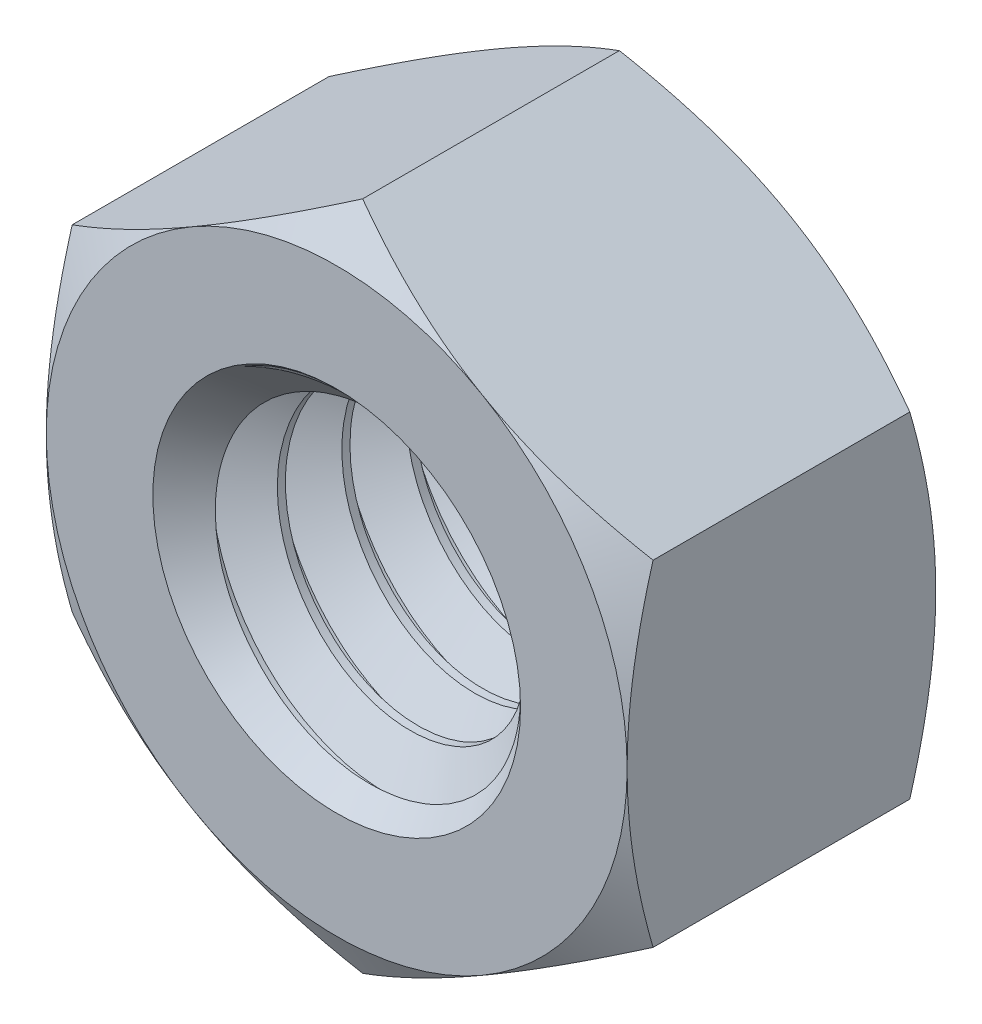
from build123d import *

# Parameters (mm, degrees)
EXTRUDE1_DEPTH     = 6.746875
SKETCH2_OUTSIDE_W  = 63.202
SKETCH2_OUTSIDE_H  = 65.166
SKETCH2_OUTSIDE_R  = 6.35
CUT_EXTRUDE6_DEPTH = 12.815504881
CUT_EXTRUDE6_DRAFT = -60
SKETCH4_OUTSIDE_W  = 40.804
SKETCH4_OUTSIDE_H  = 42.768
SKETCH4_OUTSIDE_R  = 6.35
CUT_EXTRUDE3_DEPTH = 6.35
CUT_EXTRUDE3_DRAFT = -60
SKETCH5_R          = 3.96875
CUT_EXTRUDE4_DEPTH = 12.815504881
SWEEP1_PITCH       = 1.411111111
SKETCH8_R          = 4.47675
CUT_EXTRUDE5_DEPTH = 13.561737951
CUT_EXTRUDE8_DEPTH = 12.815504992


with BuildPart() as part:
    # Sketch1 → Extrude1 (new body)
    with BuildSketch(Plane.XY):
        Polygon((0, 7.332348419), (-6.35, 3.666174209), (-6.35, -3.666174209), (0, -7.332348419), (6.35, -3.666174209), (6.35, 3.666174209), align=None)
    extrude(amount=-EXTRUDE1_DEPTH)


with BuildPart() as cut_extrude6_tool:
    # Sketch2 outside → Cut-Extrude6 (with draft: the straight prism first)
    with BuildSketch(Plane.XY):
        Rectangle(SKETCH2_OUTSIDE_W, SKETCH2_OUTSIDE_H)
        Circle(SKETCH2_OUTSIDE_R, mode=Mode.SUBTRACT)
    extrude(amount=-CUT_EXTRUDE6_DEPTH)
    # Cut-Extrude6: the draft: its side faces are tilted about the plane it starts from
    cut_extrude6_sides = [cut_extrude6_tool.faces().sort_by_distance(p)[0] for p in [
        (0, -32.583, -6.407752441),
        (31.601, 0, -6.407752441),
        (0, 32.583, -6.407752441),
        (-31.601, 0, -6.407752441),
        (-6.35, 0, -6.407752441),
    ]]
    draft(cut_extrude6_sides, Plane.XY, CUT_EXTRUDE6_DRAFT)


with BuildPart() as part_1:
    add(part.part)

    # Cut-Extrude6: cut by cut_extrude6_tool
    add(cut_extrude6_tool.part, mode=Mode.SUBTRACT)


with BuildPart() as cut_extrude3_tool:
    # Sketch4 outside → Cut-Extrude3 (with draft: the straight prism first)
    with BuildSketch(Plane(origin=(0, 0, -6.746875), x_dir=(-1, 0, 0), z_dir=(0, 0, -1))):
        Rectangle(SKETCH4_OUTSIDE_W, SKETCH4_OUTSIDE_H)
        Circle(SKETCH4_OUTSIDE_R, mode=Mode.SUBTRACT)
    extrude(amount=-CUT_EXTRUDE3_DEPTH)
    # Cut-Extrude3: the draft: its side faces are tilted about the plane it starts from
    cut_extrude3_sides = [cut_extrude3_tool.faces().sort_by_distance(p)[0] for p in [
        (0, -21.384, -3.571875),
        (-20.402, 0, -3.571875),
        (0, 21.384, -3.571875),
        (20.402, 0, -3.571875),
        (6.35, 0, -3.571875),
    ]]
    draft(cut_extrude3_sides, Plane(origin=(0, 0, -6.746875), x_dir=(-1, 0, 0), z_dir=(0, 0, -1)), CUT_EXTRUDE3_DRAFT)


with BuildPart() as part_2:
    add(part_1.part)

    # Cut-Extrude3: cut by cut_extrude3_tool
    add(cut_extrude3_tool.part, mode=Mode.SUBTRACT)

    # Sketch5 → Cut-Extrude4 (cut, through all)
    with BuildSketch(Plane.XY):
        Circle(SKETCH5_R)
    extrude(amount=-CUT_EXTRUDE4_DEPTH, mode=Mode.SUBTRACT)

    # Sweep1: the profile of Sketch7 profile screwed along a right-hand helix of 9.28125 turns, 6 arcs to a turn; built about Z, then put on its axis
    sweep1_z = Axis((0, 0, 0), (0, 0, 1))
    sweep1_corners = [(3.96935, 0, -1.235068632), (3.96935, 0, 0.00034641), (3.052206448, 0, -0.529166667), (3.052206448, 0, -0.705555556)]
    with BuildLine(mode=Mode.PRIVATE) as sweep1_profile:
        Line(sweep1_corners[0], sweep1_corners[1])
        Line(sweep1_corners[1], sweep1_corners[2])
        Line(sweep1_corners[2], sweep1_corners[3])
        Line(sweep1_corners[3], sweep1_corners[0])
    sweep1_cap = Face(sweep1_profile.wire())
    sweep1_turn_angles = [0, 30, 60, 90, 120, 150, 180, 210, 240, 270, 300, 330, 360]
    sweep1_turn_weights = [1, 0.8660254037844387, 1, 0.8660254037844387, 1, 0.8660254037844387, 1, 0.8660254037844387, 1, 0.8660254037844387, 1, 0.8660254037844387, 1]
    sweep1_turn_rails = [Edge.make_bspline([Vector(p[0], p[1], 0).rotate(sweep1_z, sweep1_turn_angles[k]) / sweep1_turn_weights[k] + Vector(0, 0, p[2] + SWEEP1_PITCH * sweep1_turn_angles[k] / 360) for k in range(13)], [0, 0, 0, 1, 1, 2, 2, 3, 3, 4, 4, 5, 5, 6, 6, 6], 2, sweep1_turn_weights) for p in sweep1_corners]
    sweep1_turn_sides = [Face.make_surface_from_curves(sweep1_turn_rails[p[0]], sweep1_turn_rails[p[1]]) for p in [(0, 1), (1, 2), (2, 3), (3, 0)]]
    sweep1_last_angles = [3240, 3270, 3300, 3320.625, 3341.25]
    sweep1_last_weights = [1, 0.8660254037844387, 1, 0.9359059267573481, 1]
    sweep1_last_rails = [Edge.make_bspline([Vector(p[0], p[1], 0).rotate(sweep1_z, sweep1_last_angles[k]) / sweep1_last_weights[k] + Vector(0, 0, p[2] + SWEEP1_PITCH * sweep1_last_angles[k] / 360) for k in range(5)], [0, 0, 0, 1, 1, 2, 2, 2], 2, sweep1_last_weights) for p in sweep1_corners]
    sweep1_last_sides = [Face.make_surface_from_curves(sweep1_last_rails[p[0]], sweep1_last_rails[p[1]]) for p in [(0, 1), (1, 2), (2, 3), (3, 0)]]
    sweep1 = Plane(origin=(0, 0, 0), x_dir=(0, 1, 0), z_dir=(0, 0, -1)) * Solid(Shell([*[p.moved(Location((0, 0, SWEEP1_PITCH * i))) for i in range(9) for p in sweep1_turn_sides], *sweep1_last_sides, sweep1_cap, sweep1_cap.rotate(sweep1_z, 3341.25).moved(Location((0, 0, SWEEP1_PITCH * 3341.25 / 360)))]))
    add(sweep1)

    # Sketch8 → Cut-Extrude5 (cut, through all)
    with BuildSketch(Plane(origin=(0, 0, -6.746875), x_dir=(-1, 0, 0), z_dir=(0, 0, -1))):
        Circle(SKETCH8_R)
    extrude(amount=CUT_EXTRUDE5_DEPTH, mode=Mode.SUBTRACT)

    # Sketch10 → Cut-Extrude8 (cut, through all)
    with BuildSketch(Plane.XY):
        with BuildLine():
            ThreePointArc((3.175, -5.499261314), (5.499261314, -3.175), (6.35, 0))
            ThreePointArc((6.35, 0), (5.499261314, 3.175), (3.175, 5.499261314))
            ThreePointArc((3.175, 5.499261314), (0, 6.35), (-3.175, 5.499261314))
            ThreePointArc((-3.175, 5.499261314), (-5.499261314, 3.175), (-6.35, 0))
            ThreePointArc((-6.35, 0), (-5.499261314, -3.175), (-3.175, -5.499261314))
            ThreePointArc((-3.175, -5.499261314), (0, -6.35), (3.175, -5.499261314))
        make_face()
    extrude(amount=CUT_EXTRUDE8_DEPTH, mode=Mode.SUBTRACT)

    # Cut-Extrude7 cone 1 section (through the dimple's axis) → Cut-Extrude7 (revolve, cut)
    with BuildSketch(Plane(origin=(0, 0, -6.746875), x_dir=(0, 1, 0), z_dir=(1, 0, 0))):
        Polygon((0, 0), (4.01955, 0), (0, 4.01955), align=None)
    revolve(axis=Axis((0, 0, -6.746875), (0, 0, 1)), mode=Mode.SUBTRACT)

    # Cut-Extrude9 cone 1 section (through the dimple's axis) → Cut-Extrude9 (revolve, cut)
    with BuildSketch(Plane(origin=(0, 0, 0), x_dir=(0, -1, 0), z_dir=(1, 0, 0))):
        Polygon((0, 0), (4.01955, 0), (0, 4.01955), align=None)
    revolve(axis=Axis((0, 0, 0), (0, 0, -1)), mode=Mode.SUBTRACT)


solid = part_2.part
